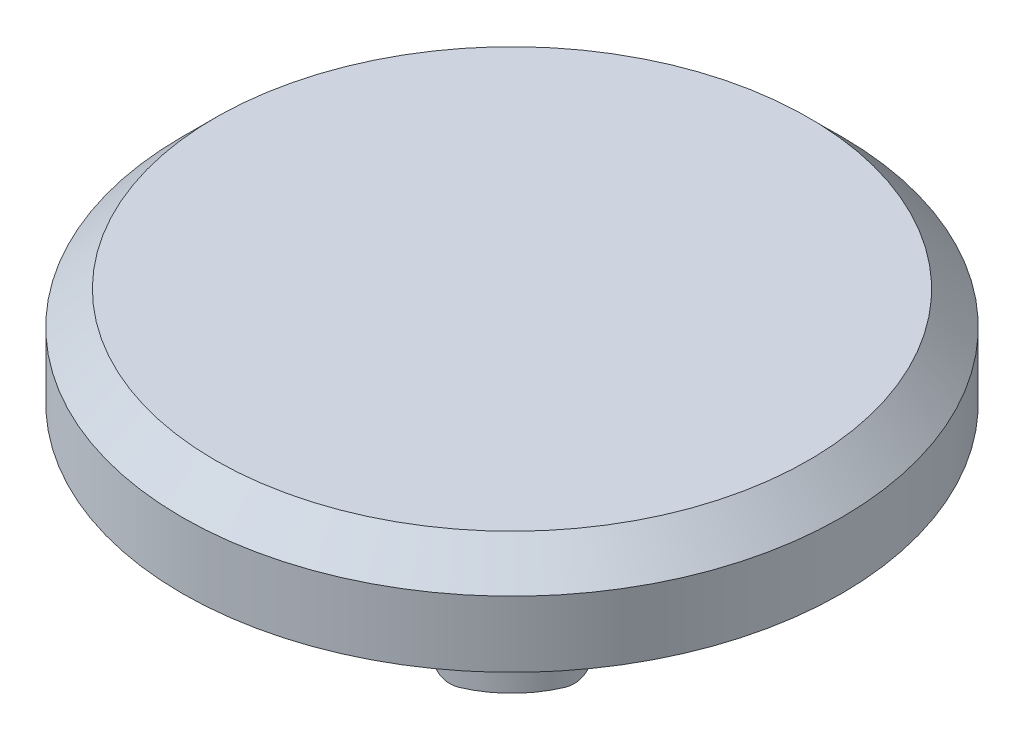
from build123d import *

# Parameters (mm, degrees)
SKETCH1_R           = 10
BOSS_EXTRUDE1_DEPTH = 3
SKETCH2_R           = 3
BOSS_EXTRUDE2_DEPTH = 5.5
CUT_EXTRUDE1_DEPTH  = 4.5
CUT_EXTRUDE2_DEPTH  = 2
FILLET3_R           = 0.6
CHAMFER1_SIZE       = 1
FILLET4_START       = -0.303359817
FILLET4_2_DEPTH     = 0.303359817


with BuildPart() as part:
    # Sketch1 → Boss-Extrude1 (new body)
    with BuildSketch(Plane(origin=(0, 0, 0), x_dir=(1, 0, 0), z_dir=(0, 1, 0))):
        with Locations(Location((0, 0, 0), (0, 0, 270))):
            Circle(SKETCH1_R)
    extrude(amount=BOSS_EXTRUDE1_DEPTH)

    # Sketch2 → Boss-Extrude2 (add)
    with BuildSketch(Plane.XZ):
        with Locations(Location((0, 0, 0), (0, 0, 90))):
            Circle(SKETCH2_R)
    extrude(amount=BOSS_EXTRUDE2_DEPTH)

    # Sketch3 → Cut-Extrude1 (cut)
    with BuildSketch(Plane.XZ.offset(5.5)):
        Polygon((0.55, 0.55), (5.536201487, 0.55), (5.536201487, -0.65), (0.55, -0.65), (0.55, -5.164287365), (-0.65, -5.164287365), (-0.65, -0.65), (-5.536201487, -0.65), (-5.536201487, 0.55), (-0.65, 0.55), (-0.65, 5.164287365), (0.55, 5.164287365), align=None)
    extrude(amount=-CUT_EXTRUDE1_DEPTH, mode=Mode.SUBTRACT)

    # Sketch4 → Cut-Extrude2 (cut)
    with BuildSketch(Plane.XZ):
        with BuildLine():
            Line((-0.834967988, 6.279069136), (-0.347460476, 5.81308022))
            add(Edge.make_bspline(
                [(-0.347460476, 5.81308022), (-0.306106117, 5.855840696), (-0.225328099, 5.939365303), (-0.095164312, 6.049944522), (0.040201287, 6.142097338), (0.178135431, 6.219707854), (0.321119155, 6.27842574), (0.467499177, 6.321214453), (0.618210178, 6.347301114), (0.720205587, 6.350285889), (0.771506538, 6.351787151)],
                knots=[0, 0, 0, 0, 1.115251505, 2.178435587, 3.19620269, 4.182487026, 5.141301733, 6.088180966, 7.038406374, 8, 8, 8, 8], degree=3))
            add(Edge.make_bspline(
                [(0.771506538, 6.351787151), (0.814349066, 6.350601102), (0.898894076, 6.348260564), (1.023028305, 6.331102112), (1.14176911, 6.301923419), (1.255522961, 6.261709774), (1.363955131, 6.209675452), (1.467292962, 6.145860726), (1.565281679, 6.070841933), (1.656626907, 5.985007225), (1.740186311, 5.891226356), (1.814016366, 5.791162393), (1.87586088, 5.685044577), (1.926615666, 5.57394759), (1.966151683, 5.45735722), (1.994385366, 5.335351962), (2.010714974, 5.207786517), (2.013152277, 5.121068477), (2.014390986, 5.076995818)],
                knots=[0, 0, 0, 0, 1.035432265, 2.043311493, 3.022114605, 3.98653278, 4.95457646, 5.923598177, 6.917315552, 7.932509744, 8.948865224, 9.949768934, 10.933144597, 11.912367597, 12.897413939, 13.903909035, 14.934704909, 16, 16, 16, 16], degree=3))
            add(Edge.make_bspline(
                [(2.014390986, 5.076995818), (2.014034004, 5.046062543), (2.013330386, 4.985092421), (2.005628036, 4.89490069), (1.993225435, 4.807393388), (1.9752758, 4.722703065), (1.952829605, 4.64075633), (1.926495106, 4.56084623), (1.893458866, 4.484076944), (1.85678814, 4.409556847), (1.814140509, 4.339319312), (1.768158495, 4.272341994), (1.718298508, 4.208953207), (1.664237603, 4.149412088), (1.605214938, 4.094649132), (1.542756032, 4.04301755), (1.47580729, 3.995809856), (1.405759405, 3.95184132), (1.332007254, 3.91364548), (1.256551903, 3.879047428), (1.178249297, 3.850948665), (1.098052816, 3.828298499), (1.016249056, 3.809037916), (0.932037899, 3.797178583), (0.84614935, 3.788197649), (0.788103108, 3.787643128), (0.758892188, 3.787364074)],
                knots=[0, 0, 0, 0, 1.103660481, 2.175337485, 3.227646561, 4.255952547, 5.262355991, 6.258840057, 7.255597736, 8.242457506, 9.22035537, 10.185017736, 11.140346927, 12.096287581, 13.051739095, 14.01125915, 14.986044842, 15.97314143, 16.960198552, 17.947847494, 18.933482797, 19.925264591, 20.920966487, 21.929612487, 22.958107872, 24, 24, 24, 24], degree=3))
            add(Edge.make_bspline(
                [(0.758892188, 3.787364074), (0.709345449, 3.788797229), (0.611998989, 3.791613005), (0.469129063, 3.813631976), (0.332988257, 3.849851938), (0.224212405, 3.892625607), (0.138989397, 3.934865162), (0.074110382, 3.973934669), (0.007020423, 4.017638203), (-0.061166173, 4.067625182), (-0.131216368, 4.123295742), (-0.201893616, 4.185869172), (-0.275007267, 4.253285019), (-0.322903296, 4.301401034), (-0.347460476, 4.326071005)],
                knots=[0, 0, 0, 0, 1.404581149, 2.759636711, 4.088442092, 5.392261763, 6.066678138, 6.783632037, 7.538459478, 8.336747902, 9.180226004, 10.074962426, 11.012997595, 12, 12, 12, 12], degree=3))
            Line((-0.347460476, 4.326071005), (-0.820127577, 3.829659247))
            add(Edge.make_bspline(
                [(-0.820127577, 3.829659247), (-0.786901624, 3.797580632), (-0.722051669, 3.734970037), (-0.624227313, 3.646068834), (-0.526526072, 3.56618122), (-0.431308206, 3.492407626), (-0.337013946, 3.426897254), (-0.243653292, 3.36958468), (-0.152283128, 3.319020385), (-0.061006122, 3.276057111), (0.030745698, 3.239576829), (0.125147538, 3.208169701), (0.222487994, 3.181600401), (0.323361577, 3.160162465), (0.426827399, 3.142972134), (0.533853763, 3.13136876), (0.64376207, 3.123568198), (0.718314577, 3.122867253), (0.755924106, 3.122513647)],
                knots=[0, 0, 0, 0, 1.244526981, 2.429050516, 3.560637417, 4.644440555, 5.67424972, 6.652764056, 7.595344123, 8.486817594, 9.369275933, 10.254498637, 11.166417451, 12.086725134, 13.032340136, 13.991389299, 14.986715468, 16, 16, 16, 16], degree=3))
            add(Edge.make_bspline(
                [(0.755924106, 3.122513647), (0.825008152, 3.124274737), (0.960186427, 3.127720701), (1.158286664, 3.15325296), (1.346476572, 3.196057342), (1.525213981, 3.256594544), (1.694442057, 3.333927983), (1.854117507, 3.428735148), (2.003982968, 3.540764151), (2.142827823, 3.668701904), (2.268419602, 3.809998412), (2.379428191, 3.961712098), (2.4712545, 4.124588579), (2.547499862, 4.29622165), (2.607122733, 4.477394539), (2.649087127, 4.668303219), (2.674966262, 4.868763357), (2.677797476, 5.005682252), (2.679241414, 5.075511777)],
                knots=[0, 0, 0, 0, 1.078019885, 2.10938526, 3.111377082, 4.085535484, 5.04941344, 6.010039228, 6.978205633, 7.964457913, 8.951525778, 9.924444315, 10.892603023, 11.863865945, 12.85144698, 13.863884204, 14.910567087, 16, 16, 16, 16], degree=3))
            add(Edge.make_bspline(
                [(2.679241414, 5.075511777), (2.678631276, 5.121053998), (2.677422131, 5.211307547), (2.664713911, 5.344258338), (2.646997912, 5.473861578), (2.618893092, 5.598771556), (2.585015503, 5.720671039), (2.54288427, 5.838235123), (2.492566683, 5.951801699), (2.435684595, 6.061560883), (2.371334459, 6.166793637), (2.299448292, 6.266595843), (2.221876725, 6.361737958), (2.136755839, 6.450957744), (2.045322553, 6.535038569), (1.947164056, 6.613524781), (1.842870722, 6.687541963), (1.732160268, 6.755181391), (1.617183502, 6.816364849), (1.499390586, 6.870331271), (1.379070921, 6.915434773), (1.256733231, 6.952846464), (1.13186064, 6.980771646), (1.005344457, 7.001910108), (0.876108181, 7.013726643), (0.789337218, 7.015661085), (0.745535818, 7.016637579)],
                knots=[0, 0, 0, 0, 1.071919942, 2.124283339, 3.142214191, 4.149696895, 5.136002878, 6.119640489, 7.086990633, 8.058538607, 9.028339693, 9.988281803, 10.952401235, 11.916291999, 12.888973767, 13.874849856, 14.873389453, 15.898127285, 16.927174885, 17.938320013, 18.946391617, 19.950418109, 20.947802303, 21.956882652, 22.968648068, 24, 24, 24, 24], degree=3))
            add(Edge.make_bspline(
                [(0.745535818, 7.016637579), (0.708168733, 7.016077828), (0.633823076, 7.014964147), (0.523109917, 7.005680404), (0.41328219, 6.99110038), (0.304733111, 6.969102228), (0.196686228, 6.942987643), (0.090561397, 6.908794195), (-0.015315558, 6.870679153), (-0.119284115, 6.825120403), (-0.221489399, 6.775388913), (-0.319537089, 6.718966731), (-0.415073398, 6.659326016), (-0.505981298, 6.592936968), (-0.59396369, 6.522207642), (-0.678560506, 6.446808046), (-0.75902936, 6.365481048), (-0.809527145, 6.308018722), (-0.834967988, 6.279069136)],
                knots=[0, 0, 0, 0, 0.996412454, 1.982464992, 2.961075852, 3.949442424, 4.934965278, 5.923860011, 6.921385422, 7.934793307, 8.949617135, 9.951082467, 10.950285876, 11.951772932, 12.951063433, 13.960125323, 14.972308753, 16, 16, 16, 16], degree=3))
        make_face()
        Polygon((-1.452329099, 7.016637579), (-2.117179526, 7.016637579), (-2.117179526, 5.924383305), (-2.544583373, 5.924383305), (-2.544583373, 5.35451151), (-2.117179526, 5.35451151), (-2.117179526, 3.217492279), (-1.452329099, 3.217492279), (-1.452329099, 5.35451151), (-1.119903885, 5.35451151), (-1.119903885, 5.924383305), (-1.452329099, 5.924383305), align=None)
    extrude(amount=-CUT_EXTRUDE2_DEPTH, mode=Mode.SUBTRACT)

    # Fillet3
    fillet3_edges = [part.edges().sort_by_distance(p)[0] for p in [
        (1.74957621, -5.5, 0.55),
        (-0.65, -5.5, 1.739368465),
        (-1.789368465, -5.5, -0.65),
        (0.55, -5.5, -1.79957621),
        (0.55, -5.5, 1.74957621),
        (-1.79957621, -5.5, 0.55),
        (-0.65, -5.5, -1.789368465),
        (1.739368465, -5.5, -0.65),
    ]]
    fillet(fillet3_edges, radius=FILLET3_R)

    # Chamfer1
    chamfer1_edges = [part.edges().sort_by_distance(p)[0] for p in [
        (0, 3, -10),
    ]]
    chamfer(chamfer1_edges, length=CHAMFER1_SIZE)

    # Fillet4: read off the stored shape, not the designer's step
    # Fillet4 outline → Fillet4 (revolve)
    with BuildSketch(Plane.XY):
        with BuildLine():
            ThreePointArc((3, -0.8), (3.234314575, -0.234314575), (3.8, 0))
            Line((3.8, 0), (3, 0))
            Line((3, 0), (3, -0.8))
        make_face()
    revolve(axis=Axis((0, 0, 0), (0, 1, 0)))

    # Fillet4 2 outline → Fillet4 2 (cut)
    with BuildSketch(Plane(origin=(0, 0, 0), x_dir=(1, 0, 0), z_dir=(0, 1, 0)).offset(FILLET4_START)):
        with BuildLine():
            Line((-1.452329099, -3.511515369), (-1.452329099, -3.217492279))
            Line((-1.452329099, -3.217492279), (-2.021816864, -3.217492279))
            ThreePointArc((-2.021816864, -3.217492279), (-1.743282805, -3.376531514), (-1.452329099, -3.511515369))
        make_face()
        with BuildLine():
            add(Edge.make_bspline(
                [(-0.717504439, -3.731646738), (-0.686203446, -3.702392774), (-0.623361366, -3.645360773), (-0.526526072, -3.56618122), (-0.431308206, -3.492407626), (-0.337013946, -3.426897254), (-0.243653292, -3.36958468), (-0.152283128, -3.319020385), (-0.061006122, -3.276057111), (0.030745698, -3.239576829), (0.125147538, -3.208169701), (0.222487994, -3.181600401), (0.323361577, -3.160162465), (0.426827399, -3.142972134), (0.533853763, -3.13136876), (0.64376207, -3.123568198), (0.718314577, -3.122867253), (0.755924106, -3.122513647)],
                knots=[0.079666321, 0.079666321, 0.079666321, 0.079666321, 0.151815657, 0.222539839, 0.290277535, 0.354640607, 0.415797753, 0.474709008, 0.5304261, 0.585579746, 0.640906165, 0.697901091, 0.755420321, 0.814521258, 0.874461831, 0.936669717, 1, 1, 1, 1], degree=3))
            ThreePointArc((-0.717504439, -3.731646738), (0.549009685, -3.760131429), (1.754506577, -3.370713081))
            add(Edge.make_bspline(
                [(0.755924106, -3.122513647), (0.825008152, -3.124274737), (0.960186427, -3.127720701), (1.158286664, -3.15325296), (1.346476572, -3.196057342), (1.525213981, -3.256594544), (1.659634947, -3.318021913), (1.73426641, -3.359048476), (1.754506577, -3.370713081)],
                knots=[0, 0, 0, 0, 0.067376243, 0.131836579, 0.194461068, 0.255345968, 0.31558834, 0.33836485, 0.33836485, 0.33836485, 0.33836485], degree=3))
        make_face()
    extrude(amount=FILLET4_2_DEPTH, mode=Mode.SUBTRACT)


solid = part.part
